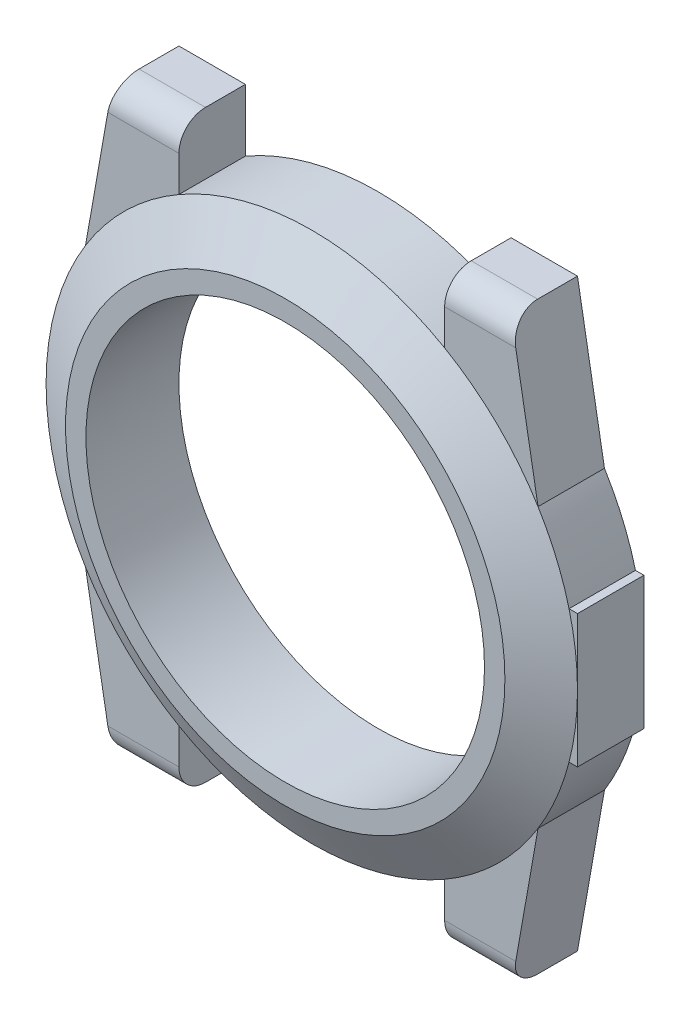
from build123d import *

# Parameters (mm, degrees)
ESQUISSE1_R        = 15
BOSS_EXTRU_1_DEPTH = 5
ESQUISSE5_R        = 20
ESQUISSE5_R_2      = 15
BOSS_EXTRU_2_DEPTH = 2
CHANFREIN2_SIZE    = 2
CHANFREIN2_SIZE_2  = 3.464101615
CONG_1_R           = 2


with BuildPart() as part:
    # Esquisse1 → Boss.-Extru.1 (new body)
    with BuildSketch(Plane.XY):
        with BuildLine():
            Line((-10, 17.320508076), (-10, 22))
            Line((-10, 22), (-15, 22))
            Line((-15, 22), (-17.030050858, 10.487009478))
            ThreePointArc((-17.030050858, 10.487009478), (-20, 0), (-17.030050858, -10.487009478))
            Line((-17.030050858, -10.487009478), (-15, -22))
            Line((-15, -22), (-10, -22))
            Line((-10, -22), (-10, -17.320508076))
            ThreePointArc((-10, -17.320508076), (0, -20), (10, -17.320508076))
            Line((10, -17.320508076), (10, -22))
            Line((10, -22), (15, -22))
            Line((15, -22), (17.030050858, -10.487009478))
            ThreePointArc((17.030050858, -10.487009478), (18.403131111, -7.831013044), (19.364916731, -5))
            Line((19.364916731, -5), (20, -5))
            Line((20, -5), (20, 5))
            Line((20, 5), (19.364916731, 5))
            ThreePointArc((19.364916731, 5), (18.403131111, 7.831013044), (17.030050858, 10.487009478))
            Line((17.030050858, 10.487009478), (15, 22))
            Line((15, 22), (10, 22))
            Line((10, 22), (10, 17.320508076))
            ThreePointArc((10, 17.320508076), (0, 20), (-10, 17.320508076))
        make_face()
        Circle(ESQUISSE1_R, mode=Mode.SUBTRACT)
    extrude(amount=BOSS_EXTRU_1_DEPTH)

    # Esquisse5 → Boss.-Extru.2 (add)
    with BuildSketch(Plane.XY.offset(5)):
        Circle(ESQUISSE5_R)
        Circle(ESQUISSE5_R_2, mode=Mode.SUBTRACT)
    extrude(amount=BOSS_EXTRU_2_DEPTH)

    # Chanfrein2
    # the kernel refuses this chamfer: 3.464101615, 2 mm, written as the material it takes off along each edge
    with BuildSketch(Plane(origin=(0, 0, 7), x_dir=(1, 0, 0), z_dir=(0, -1, 0))) as chanfrein2_piece_1:
        Polygon((20, -CHANFREIN2_SIZE), (20 - CHANFREIN2_SIZE_2, 0), (20, 0), align=None)
    revolve(axis=Axis((0, 0, 7), (0, 0, 1)), mode=Mode.SUBTRACT)

    # Congé1
    cong_1_edges = [part.edges().sort_by_distance(p)[0] for p in [
        (12.5, -22, 5),
        (-12.5, -22, 5),
        (12.5, 22, 5),
        (-12.5, 22, 5),
    ]]
    fillet(cong_1_edges, radius=CONG_1_R)


solid = part.part
